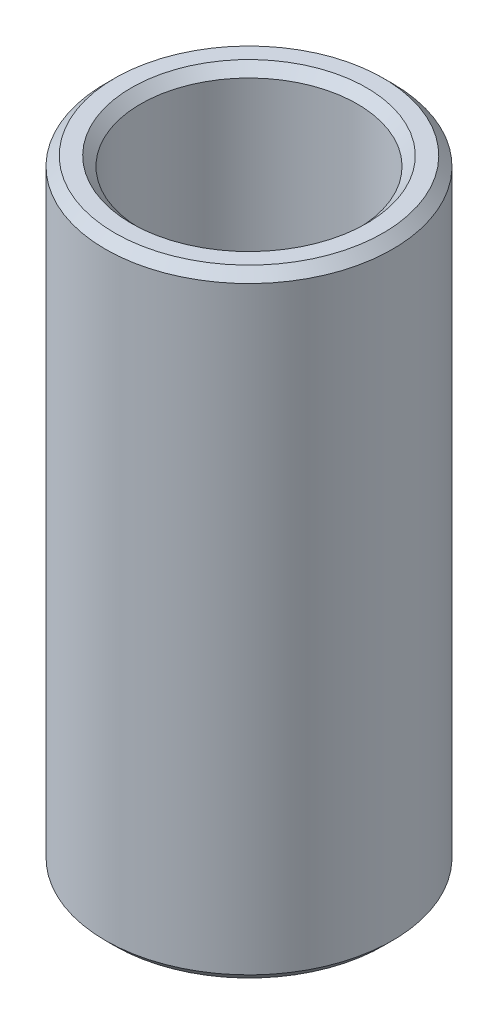
from build123d import *

# Parameters (mm, degrees)
SKETCH1_R           = 50
BOSS_EXTRUDE1_DEPTH = 215.04532579
SKETCH2_R           = 37.704515191
CUT_EXTRUDE1_DEPTH  = 227.372463308
CHAMFER1_SIZE       = 3.258673004


with BuildPart() as part:
    # Sketch1 → Boss-Extrude1 (new body)
    with BuildSketch(Plane(origin=(0, 0, 0), x_dir=(1, 0, 0), z_dir=(0, 1, 0))):
        Circle(SKETCH1_R)
    extrude(amount=BOSS_EXTRUDE1_DEPTH)

    # Sketch2 → Cut-Extrude1 (cut, through all)
    with BuildSketch(Plane(origin=(0, 0, 0), x_dir=(1, 0, 0), z_dir=(0, 1, 0))):
        Circle(SKETCH2_R)
    extrude(amount=CUT_EXTRUDE1_DEPTH, mode=Mode.SUBTRACT)

    # Chamfer1
    chamfer1_edges = [part.edges().sort_by_distance(p)[0] for p in [
        (-37.704515191, 215.04532579, 0),
        (-37.704515191, 0, 0),
        (-50, 0, 0),
        (-50, 215.04532579, 0),
    ]]
    chamfer(chamfer1_edges, length=CHAMFER1_SIZE)


solid = part.part
